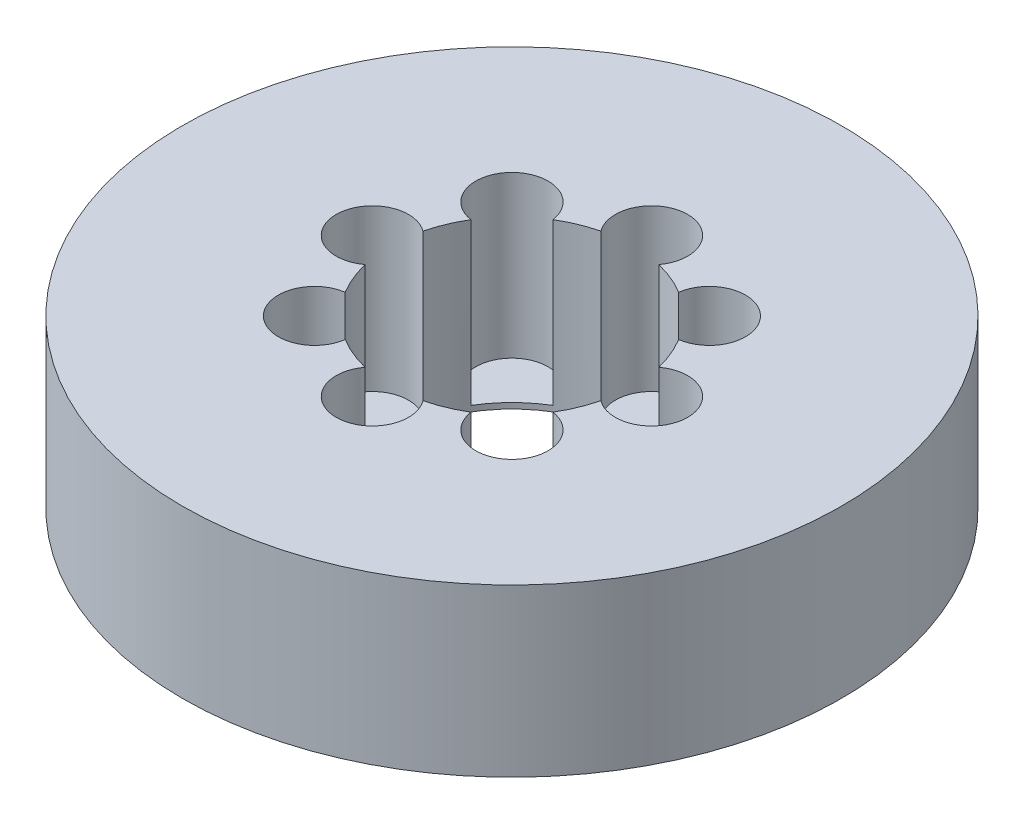
from build123d import *

# Parameters (mm, degrees)
SKETCH1_R           = 47.5
BOSS_EXTRUDE1_DEPTH = 24
SKETCH2_R           = 17.5
CUT_EXTRUDE1_DEPTH  = 72.33372274
SKETCH3_R           = 5.21463171
CUT_EXTRUDE2_DEPTH  = 23.183363877
CIRPATTERN1_COUNT   = 8


with BuildPart() as part:
    # Sketch1 → Boss-Extrude1 (new body)
    with BuildSketch(Plane(origin=(0, 0, 0), x_dir=(1, 0, 0), z_dir=(0, 1, 0))):
        Circle(SKETCH1_R)
    extrude(amount=BOSS_EXTRUDE1_DEPTH)

    # Sketch2 → Cut-Extrude1 (cut, through all)
    with BuildSketch(Plane(origin=(0, 0, 0), x_dir=(1, 0, 0), z_dir=(0, 1, 0))):
        Circle(SKETCH2_R)
    extrude(amount=CUT_EXTRUDE1_DEPTH, mode=Mode.SUBTRACT)

    # Sketch3 → Cut-Extrude2 (cut)
    with BuildSketch(Plane(origin=(0, 24, 0), x_dir=(1, 0, 0), z_dir=(0, 1, 0))):
        with Locations((-20.118240623, 0)):
            Circle(SKETCH3_R)
    cut_extrude2 = extrude(amount=-CUT_EXTRUDE2_DEPTH, mode=Mode.SUBTRACT)

    # CirPattern1: Cut-Extrude2 ×8 about axis
    cirpattern1_axis = Axis((0, 0, 0), (0, 1, 0))
    for i in range(1, CIRPATTERN1_COUNT):
        add(cut_extrude2.rotate(cirpattern1_axis, i * 360 / CIRPATTERN1_COUNT), mode=Mode.SUBTRACT)


solid = part.part
